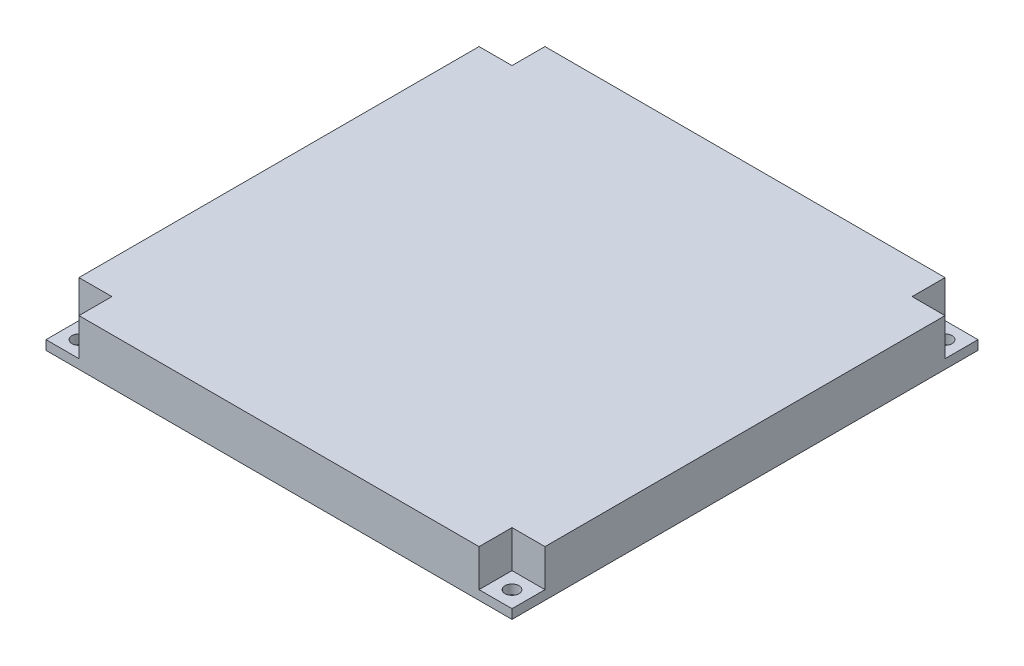
from build123d import *

# Parameters (mm, degrees)
CROQUIS1_W              = 100
CROQUIS1_H              = 100
SALIENTE_EXTRUIR1_DEPTH = 10
CROQUIS2_R              = 1.5
CORTAR_EXTRUIR1_DEPTH   = 30
CROQUIS3_W              = 7.071067812
CROQUIS3_H              = 7.071067812
CORTAR_EXTRUIR2_DEPTH   = 8
VACIADO1_START          = -48
VACIADO1_OUTLINE_W      = 8
VACIADO1_OUTLINE_H      = 81.857864376
VACIADO1_DEPTH          = 96
VACIADO1_START_2        = -40.928932188
VACIADO1_2_OUTLINE_W    = 8
VACIADO1_2_OUTLINE_H    = 7.071067812
VACIADO1_2_DEPTH        = 81.857864376


# Read off the part's stored shape, not the designer's step: Vaciado1
with BuildPart() as part:
    # Croquis1 → Saliente-Extruir1 (new body)
    with BuildSketch(Plane(origin=(0, 0, 0), x_dir=(1, 0, 0), z_dir=(0, 1, 0))):
        Rectangle(CROQUIS1_W, CROQUIS1_H)
    extrude(amount=SALIENTE_EXTRUIR1_DEPTH)

    # Croquis2 → Cortar-Extruir1 (cut)
    with BuildSketch(Plane(origin=(0, 10, 0), x_dir=(1, 0, 0), z_dir=(0, 1, 0))):
        with Locations(Location((-46.464466094, -46.464466094, 0), (0, 0, 270))):
            Circle(CROQUIS2_R)
        with Locations(Location((-46.464466094, 46.464466094, 0), (0, 0, 270))):
            Circle(CROQUIS2_R)
        with Locations(Location((46.464466094, 46.464466094, 0), (0, 0, 270))):
            Circle(CROQUIS2_R)
        with Locations(Location((46.464466094, -46.464466094, 0), (0, 0, 270))):
            Circle(CROQUIS2_R)
    extrude(amount=-CORTAR_EXTRUIR1_DEPTH, mode=Mode.SUBTRACT)

    # Croquis3 → Cortar-Extruir2 (cut)
    with BuildSketch(Plane(origin=(0, 10, 0), x_dir=(1, 0, 0), z_dir=(0, 1, 0))):
        with Locations((-46.464466094, -46.464466094)):
            Rectangle(CROQUIS3_W, CROQUIS3_H)
        with Locations((-46.464466094, 46.464466094)):
            Rectangle(CROQUIS3_W, CROQUIS3_H)
        with Locations((46.464466094, 46.464466094)):
            Rectangle(CROQUIS3_W, CROQUIS3_H)
        with Locations((46.464466094, -46.464466094)):
            Rectangle(CROQUIS3_W, CROQUIS3_H)
    extrude(amount=-CORTAR_EXTRUIR2_DEPTH, mode=Mode.SUBTRACT)

    # Vaciado1 outline → Vaciado1 (cut)
    with BuildSketch(Plane.YZ.offset(VACIADO1_START)):
        with Locations((4, 0)):
            Rectangle(VACIADO1_OUTLINE_W, VACIADO1_OUTLINE_H)
    extrude(amount=VACIADO1_DEPTH, mode=Mode.SUBTRACT)

    # Vaciado1 2 outline → Vaciado1 2 (cut)
    with BuildSketch(Plane.YZ.offset(VACIADO1_START_2)):
        with Locations((4, -44.464466094)):
            Rectangle(VACIADO1_2_OUTLINE_W, VACIADO1_2_OUTLINE_H)
        with Locations((4, 44.464466094)):
            Rectangle(VACIADO1_2_OUTLINE_W, VACIADO1_2_OUTLINE_H)
    extrude(amount=VACIADO1_2_DEPTH, mode=Mode.SUBTRACT)


solid = part.part
